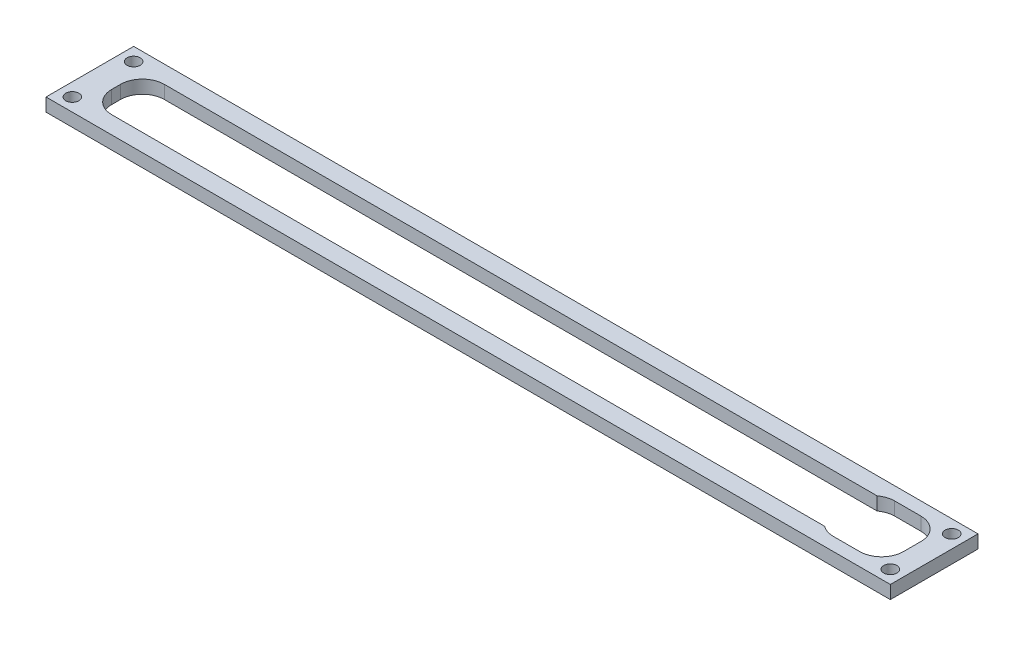
from build123d import *

# Parameters (mm, degrees)
SKETCH1_W           = 192.641732707
SKETCH1_H           = 20
SKETCH1_R           = 1.5
SKETCH1_W_2         = 180.641732707
SKETCH1_H_2         = 12
BOSS_EXTRUDE1_DEPTH = 3
CUT_EXTRUDE1_DEPTH  = 194.700379918
FILLET1_R           = 5


with BuildPart() as part:
    # Sketch1 → Boss-Extrude1 (new body)
    with BuildSketch(Plane(origin=(0, 0, 0), x_dir=(1, 0, 0), z_dir=(0, 1, 0))):
        with Locations((96.320866354, 10)):
            Rectangle(SKETCH1_W, SKETCH1_H)
        with Locations(Location((3, 17, 0), (0, 0, 270))):
            Circle(SKETCH1_R, mode=Mode.SUBTRACT)
        with Locations(Location((3, 3, 0), (0, 0, 90))):
            Circle(SKETCH1_R, mode=Mode.SUBTRACT)
        with Locations(Location((189.641732707, 3, 0), (0, 0, 270))):
            Circle(SKETCH1_R, mode=Mode.SUBTRACT)
        with Locations(Location((189.641732707, 17, 0), (0, 0, 90))):
            Circle(SKETCH1_R, mode=Mode.SUBTRACT)
        with Locations((96.320866354, 10)):
            Rectangle(SKETCH1_W_2, SKETCH1_H_2, mode=Mode.SUBTRACT)
    extrude(amount=BOSS_EXTRUDE1_DEPTH)

    # Sketch2 → Cut-Extrude1 (cut, through all)
    with BuildSketch(Plane(origin=(0, 3, 0), x_dir=(1, 0, 0), z_dir=(0, 1, 0))):
        Polygon((173.641732707, 17), (173.641732707, 16), (186.641732707, 16), (186.641732707, 4), (173.641732707, 4), (173.641732707, 3), (187.641732707, 3), (187.641732707, 17), align=None)
    extrude(amount=-CUT_EXTRUDE1_DEPTH, mode=Mode.SUBTRACT)

    # Fillet1
    # the kernel refuses this fillet: 5 mm, written as the material it adds along each edge
    with BuildSketch(Plane(origin=(187.641732707, 3, -17), x_dir=(0, 0, 1), z_dir=(0, -1, 0)), Plane(origin=(187.641732707, 3, -3), x_dir=(-1, 0, 0), z_dir=(0, -1, 0)), Plane(origin=(6, 0, -16), x_dir=(0, 0, 1), z_dir=(0, 1, 0))) as fillet1_piece_1:
        with BuildLine():
            CenterArc((FILLET1_R, FILLET1_R), FILLET1_R, 180, 90)
            Line((0, FILLET1_R), (-FILLET1_R * 0.02, FILLET1_R))
            Line((-FILLET1_R * 0.02, FILLET1_R), (-FILLET1_R * 0.02, -FILLET1_R * 0.02))
            Line((-FILLET1_R * 0.02, -FILLET1_R * 0.02), (FILLET1_R, -FILLET1_R * 0.02))
            Line((FILLET1_R, -FILLET1_R * 0.02), (FILLET1_R, 0))
        make_face()
    extrude(amount=3)
    with BuildSketch(Plane(origin=(173.641732707, 3, -17), x_dir=(1, 0, 0), z_dir=(0, -1, 0))) as fillet1_piece_2:
        with BuildLine():
            CenterArc((3, 5), FILLET1_R, 233.130102354, 36.869897646)
            Line((0, 1), (-0.06, 0.92))
            ThreePointArc((-0.06, 0.92), (-0.1, 0.5), (-0.1, 0))
            Line((-0.1, 0), (0, -0.1))
            Line((0, -0.1), (3, -0.1))
            Line((3, -0.1), (3, 0))
        make_face()
    extrude(amount=3)
    with BuildSketch(Plane(origin=(173.641732707, 3, -3), x_dir=(0, 0, -1), z_dir=(0, -1, 0))) as fillet1_piece_3:
        with BuildLine():
            CenterArc((5, 3), FILLET1_R, 180, 36.869897646)
            Line((0, 3), (-0.1, 3))
            Line((-0.1, 3), (-0.1, 0))
            Line((-0.1, 0), (0, -0.1))
            ThreePointArc((0, -0.1), (0.5, -0.1), (0.92, -0.06))
            Line((0.92, -0.06), (1, 0))
        make_face()
    extrude(amount=3)
    with BuildSketch(Plane(origin=(6, 0, -4), x_dir=(0, 0, -1), z_dir=(0, 1, 0))) as fillet1_piece_4:
        with BuildLine():
            CenterArc((FILLET1_R, -FILLET1_R), FILLET1_R, 90, 90)
            Line((0, -FILLET1_R), (-FILLET1_R * 0.02, -FILLET1_R))
            Line((-FILLET1_R * 0.02, -FILLET1_R), (-FILLET1_R * 0.02, FILLET1_R * 0.02))
            Line((-FILLET1_R * 0.02, FILLET1_R * 0.02), (FILLET1_R, FILLET1_R * 0.02))
            Line((FILLET1_R, FILLET1_R * 0.02), (FILLET1_R, 0))
        make_face()
    extrude(amount=3)


solid = part.part
